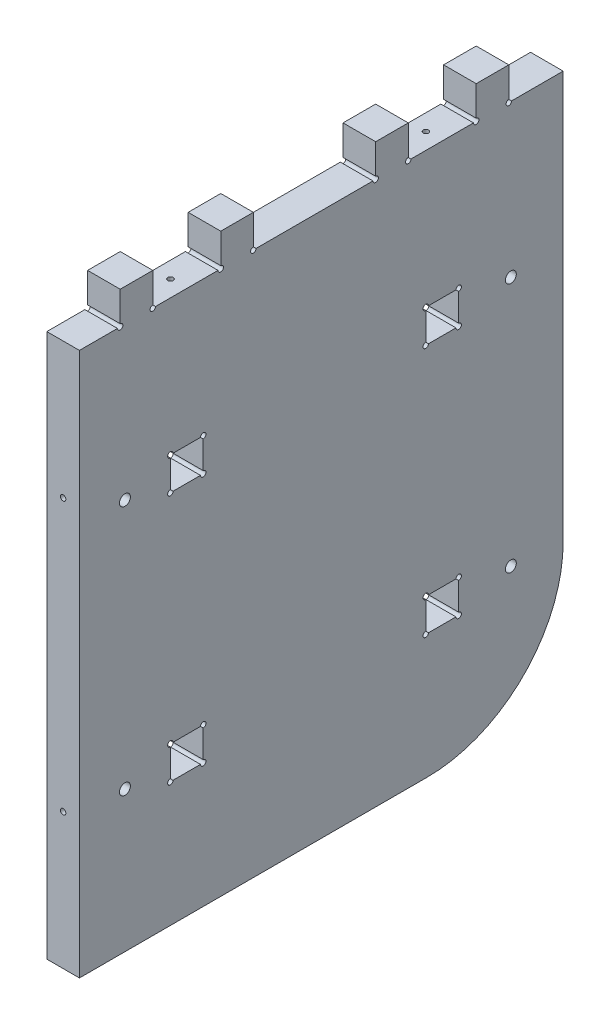
from build123d import *

# Parameters (mm, degrees)
SKETCH1_R           = 2
SKETCH1_W           = 12.1
SKETCH1_H           = 12.1
BOSS_EXTRUDE1_DEPTH = 12
SKETCH2_R           = 0.9921875
CUT_EXTRUDE1_DEPTH  = 15
CUT_EXTRUDE2_START  = 108.950538
SKETCH4_R           = 0.9921875
CUT_EXTRUDE2_DEPTH  = 15
SKETCH5_R           = 1
CUT_EXTRUDE3_DEPTH  = 15


# Read off the part's stored shape, not the designer's step: AdvancedHole1
with BuildPart() as part:
    # Sketch1 → Boss-Extrude1 (new body)
    with BuildSketch(Plane(origin=(0, 0, 0), x_dir=(0, 0, -1), z_dir=(1, 0, 0))):
        with BuildLine():
            Line((-72.5, 120.950537961), (-72.5, 108.950537961))
            Line((-72.5, 108.950537961), (-87.5, 108.950537961))
            Line((-87.5, 108.950537961), (-87.5, -91.049462039))
            Line((-87.5, -91.049462039), (40.5, -91.049462039))
            ThreePointArc((40.5, -91.049462039), (75.855339059, -76.404801099), (90.5, -41.049462039))
            Line((90.5, -41.049462039), (90.5, 108.950537961))
            Line((90.5, 108.950537961), (70.5, 108.950537961))
            Line((70.5, 108.950537961), (70.5, 120.950537961))
            Line((70.5, 120.950537961), (58.5, 120.950537961))
            Line((58.5, 120.950537961), (58.5, 108.950537961))
            Line((58.5, 108.950537961), (33.5, 108.950537961))
            Line((33.5, 108.950537961), (33.5, 120.950537961))
            Line((33.5, 120.950537961), (21.5, 120.950537961))
            Line((21.5, 120.950537961), (21.5, 108.950537961))
            Line((21.5, 108.950537961), (-23.5, 108.950537961))
            Line((-23.5, 108.950537961), (-23.5, 120.950537961))
            Line((-23.5, 120.950537961), (-35.5, 120.950537961))
            Line((-35.5, 120.950537961), (-35.5, 108.950537961))
            Line((-35.5, 108.950537961), (-60.5, 108.950537961))
            Line((-60.5, 108.950537961), (-60.5, 120.950537961))
            Line((-60.5, 120.950537961), (-72.5, 120.950537961))
        make_face()
        with Locations((71.25, 52.900537961)):
            Circle(SKETCH1_R, mode=Mode.SUBTRACT)
        with Locations((71.25, -39.199462039)):
            Circle(SKETCH1_R, mode=Mode.SUBTRACT)
        with Locations((-70.75, 52.900537961)):
            Circle(SKETCH1_R, mode=Mode.SUBTRACT)
        with Locations((-70.75, -39.199462039)):
            Circle(SKETCH1_R, mode=Mode.SUBTRACT)
        with Locations((46, 52.900537961)):
            Rectangle(SKETCH1_W, SKETCH1_H, mode=Mode.SUBTRACT)
        with Locations((46, -39.199462039)):
            Rectangle(SKETCH1_W, SKETCH1_H, mode=Mode.SUBTRACT)
        with Locations((-48, 52.900537961)):
            Rectangle(SKETCH1_W, SKETCH1_H, mode=Mode.SUBTRACT)
        with Locations((-48, -39.199462039)):
            Rectangle(SKETCH1_W, SKETCH1_H, mode=Mode.SUBTRACT)
    extrude(amount=BOSS_EXTRUDE1_DEPTH)

    # Sketch2 → Cut-Extrude1 (cut)
    with BuildSketch(Plane.XY.offset(87.5)):
        with Locations((6, 58.950537961)):
            Circle(SKETCH2_R)
        with Locations((6, -41.049462039)):
            Circle(SKETCH2_R)
    extrude(amount=-CUT_EXTRUDE1_DEPTH, mode=Mode.SUBTRACT)

    # Sketch4 → Cut-Extrude2 (cut)
    with BuildSketch(Plane(origin=(0, 0, 0), x_dir=(1, 0, 0), z_dir=(0, 1, 0)).offset(CUT_EXTRUDE2_START)):
        with Locations(Location((6, 46, 0), (0, 0, 90))):
            Circle(SKETCH4_R)
        with Locations(Location((6, -48, 0), (0, 0, 90))):
            Circle(SKETCH4_R)
    extrude(amount=-CUT_EXTRUDE2_DEPTH, mode=Mode.SUBTRACT)

    # Sketch5 → Cut-Extrude3 (cut)
    with BuildSketch(Plane(origin=(0, 0, 0), x_dir=(0, 0, -1), z_dir=(1, 0, 0))):
        with Locations((-54.05, 58.950537961)):
            Circle(SKETCH5_R)
        with Locations((-41.95, 58.950537961)):
            Circle(SKETCH5_R)
        with Locations((-41.95, 46.850537961)):
            Circle(SKETCH5_R)
        with Locations((-54.05, 46.850537961)):
            Circle(SKETCH5_R)
        with Locations((39.95, 58.950537961)):
            Circle(SKETCH5_R)
        with Locations((52.05, 58.950537961)):
            Circle(SKETCH5_R)
        with Locations((52.05, 46.850537961)):
            Circle(SKETCH5_R)
        with Locations((39.95, 46.850537961)):
            Circle(SKETCH5_R)
        with Locations((-41.95, -33.149462039)):
            Circle(SKETCH5_R)
        with Locations((-54.05, -33.149462039)):
            Circle(SKETCH5_R)
        with Locations((-41.95, -45.249462039)):
            Circle(SKETCH5_R)
        with Locations((-54.05, -45.249462039)):
            Circle(SKETCH5_R)
        with Locations((39.95, -33.149462039)):
            Circle(SKETCH5_R)
        with Locations((52.05, -33.149462039)):
            Circle(SKETCH5_R)
        with Locations((52.05, -45.249462039)):
            Circle(SKETCH5_R)
        with Locations((39.95, -45.249462039)):
            Circle(SKETCH5_R)
        with Locations((21.5, 108.950537961)):
            Circle(SKETCH5_R)
        with Locations((33.5, 108.950537961)):
            Circle(SKETCH5_R)
        with Locations((58.5, 108.950537961)):
            Circle(SKETCH5_R)
        with Locations((70.5, 108.950537961)):
            Circle(SKETCH5_R)
        with Locations((-23.5, 108.950537961)):
            Circle(SKETCH5_R)
        with Locations((-35.5, 108.950537961)):
            Circle(SKETCH5_R)
        with Locations((-60.5, 108.950537961)):
            Circle(SKETCH5_R)
        with Locations((-72.5, 108.950537961)):
            Circle(SKETCH5_R)
    extrude(amount=CUT_EXTRUDE3_DEPTH, mode=Mode.SUBTRACT)

    # AdvancedHole1 outline → AdvancedHole1 (revolve, cut)
    with BuildSketch(Plane(origin=(0, -39.199462039, -71.25), x_dir=(0, 1, 0), z_dir=(0, 0, -1))):
        Polygon((3.8989, 0), (2, 2.184434568), (2, 0), align=None)
    revolve(axis=Axis((0, -39.199462039, -71.25), (1, 0, 0)), mode=Mode.SUBTRACT)

    # AdvancedHole1 2 outline → AdvancedHole1 2 (revolve, cut)
    with BuildSketch(Plane(origin=(0, -39.149462039, 70.75), x_dir=(0, 1, 0), z_dir=(0, 0, -1))):
        Polygon((3.8989, 0), (1.949985604, 2.24196955), (1.949985604, 0), align=None)
    revolve(axis=Axis((0, -39.149462039, 70.75), (1, 0, 0)), mode=Mode.SUBTRACT)

    # AdvancedHole1 3 outline → AdvancedHole1 3 (revolve, cut)
    with BuildSketch(Plane(origin=(0, 52.900537961, -71.25), x_dir=(0, 1, 0), z_dir=(0, 0, -1))):
        Polygon((3.8989, 0), (2, 2.184434568), (2, 0), align=None)
    revolve(axis=Axis((0, 52.900537961, -71.25), (1, 0, 0)), mode=Mode.SUBTRACT)

    # AdvancedHole1 4 outline → AdvancedHole1 4 (revolve, cut)
    with BuildSketch(Plane(origin=(0, 52.900537961, 70.75), x_dir=(0, 1, 0), z_dir=(0, 0, -1))):
        Polygon((3.8989, 0), (2, 2.184434568), (2, 0), align=None)
    revolve(axis=Axis((0, 52.900537961, 70.75), (1, 0, 0)), mode=Mode.SUBTRACT)


solid = part.part
